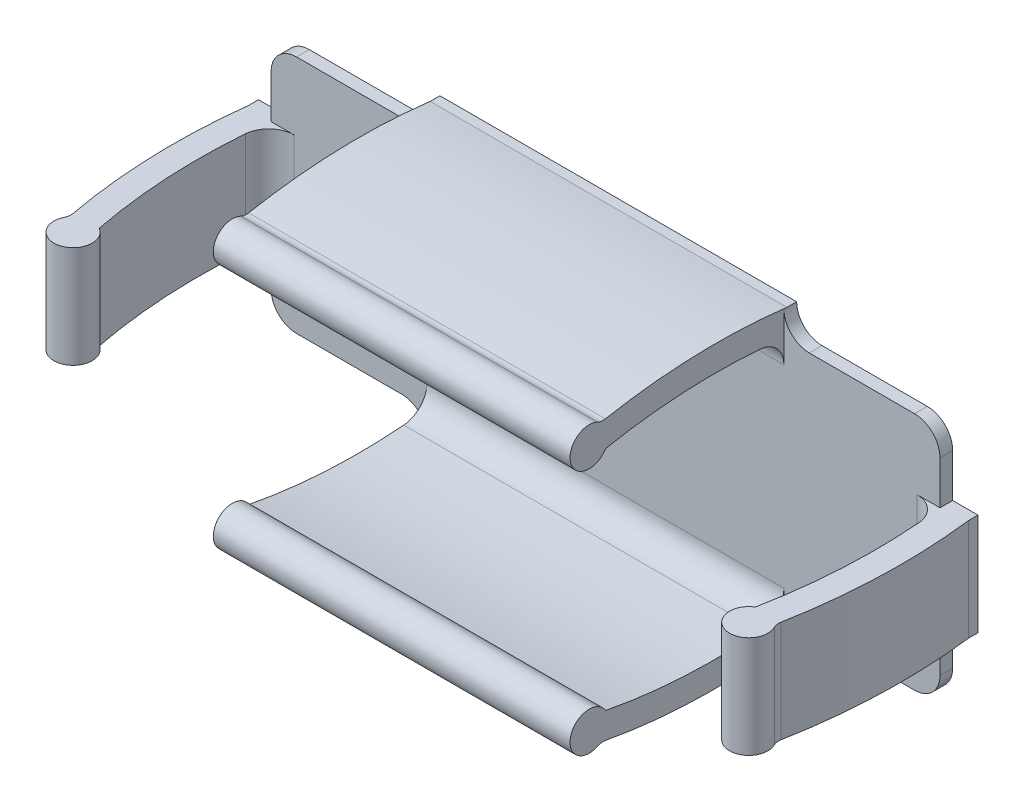
from build123d import *

# Parameters (mm, degrees)
SKETCH1_W           = 52.5
SKETCH1_H           = 18.8
BOSS_EXTRUDE1_DEPTH = 1
BOSS_EXTRUDE2_DEPTH = 4
BOSS_EXTRUDE3_DEPTH = 14
FILLET1_R           = 2
FILLET2_R           = 2
FILLET3_R           = 1


with BuildPart() as part:
    # Sketch1 → Boss-Extrude1 (new body)
    with BuildSketch(Plane.XY):
        Rectangle(SKETCH1_W, SKETCH1_H)
    extrude(amount=BOSS_EXTRUDE1_DEPTH)

    # Sketch2 → Boss-Extrude2 (add, symmetric)
    with BuildSketch(Plane(origin=(0, 0, 0), x_dir=(1, 0, 0), z_dir=(0, 1, 0))):
        with BuildLine():
            Line((-26.25, 0), (-26.25, -1))
            ThreePointArc((-26.25, -1), (-26.547428998, -8.015097806), (-25.75, -14.99106858))
            ThreePointArc((-25.75, -14.99106858), (-26.232288437, -17.75177498), (-27.713282794, -15.372540297))
            ThreePointArc((-27.713282794, -15.372540297), (-28.546153081, -8.086526378), (-28.235505016, -0.759646447))
            Line((-28.235505016, -0.759646447), (-28.235505016, 0))
            Line((-28.235505016, 0), (-26.25, 0))
        make_face()
    boss_extrude2 = extrude(amount=BOSS_EXTRUDE2_DEPTH, both=True)

    # Mirror1: Boss-Extrude2 across plane
    add(boss_extrude2.mirror(Plane(origin=(0, 0, 0), x_dir=(0, 0, 1), z_dir=(1, 0, 0))))

    # Sketch3 → Boss-Extrude3 (add, symmetric)
    with BuildSketch(Plane(origin=(0, 0, 0), x_dir=(0, 0, -1), z_dir=(1, 0, 0))):
        with BuildLine():
            Line((0, 9.4), (-1, 9.4))
            ThreePointArc((-1, 9.4), (-8.019576143, 9.698132003), (-15, 8.9))
            ThreePointArc((-15, 8.9), (-17.760743831, 9.382074127), (-15.381624121, 10.863253175))
            ThreePointArc((-15.381624121, 10.863253175), (-8.090959204, 11.696857712), (-0.759401899, 11.385475397))
            Line((-0.759401899, 11.385475397), (0, 11.385475397))
            Line((0, 11.385475397), (0, 9.4))
        make_face()
    boss_extrude3 = extrude(amount=BOSS_EXTRUDE3_DEPTH, both=True)

    # Mirror2: Boss-Extrude3 across plane
    add(boss_extrude3.mirror(Plane.ZX))

    # Fillet1
    fillet1_edges = [part.edges().sort_by_distance(p)[0] for p in [
        (0, 9.4, 1),
        (-26.25, 0, 1),
        (0, -9.4, 1),
        (26.25, 0, 1),
        (26.25, -9.4, 0.5),
        (26.25, 9.4, 0.5),
        (-26.25, -9.4, 0.5),
        (-26.25, 9.4, 0.5),
    ]]
    fillet(fillet1_edges, radius=FILLET1_R)

    # Fillet2
    # the kernel refuses this fillet: 2 mm, written as the material it adds along each edge
    with BuildSketch(Plane(origin=(-14, -9.4, 0), x_dir=(0, -1, 0), z_dir=(0, 0, 1))) as fillet2_piece_1_section:
        with BuildLine():
            CenterArc((FILLET2_R, -FILLET2_R), FILLET2_R, 90, 90)
            Line((0, -FILLET2_R), (0, 0))
            Line((0, 0), (FILLET2_R, 0))
        make_face()
    fillet2_piece_1 = extrude(amount=1, mode=Mode.PRIVATE)
    fillet2_piece_1 = split(fillet2_piece_1, bisect_by=Plane(origin=(-14.000636708, -11.385475397, 0.169006007), z_dir=(0, 1, 0)), keep=Keep.TOP, mode=Mode.PRIVATE)
    add(fillet2_piece_1)
    with BuildSketch(Plane(origin=(-14, -9.4, -5), x_dir=(0, -1, 0), z_dir=(0, 0, 1))) as fillet2_piece_2_section:
        with BuildLine():
            CenterArc((FILLET2_R, -FILLET2_R), FILLET2_R, 90, 90)
            Line((0, -FILLET2_R), (0, 0))
            Line((0, 0), (FILLET2_R, 0))
        make_face()
    fillet2_piece_2 = extrude(amount=6, mode=Mode.PRIVATE)
    fillet2_piece_2 = split(fillet2_piece_2, bisect_by=Plane(origin=(-14.000016578, -11.385475397, 0.893450241), z_dir=(0, -1, 0)), keep=Keep.TOP, mode=Mode.PRIVATE)
    fillet2_piece_2 = fillet2_piece_2 & Plane(origin=(-14.000016578, 35.273196442, 6.41345727), x_dir=(0, -0.9816265876102759, 0.19081206066862103), z_dir=(1, 0, 0)) * Cylinder(47, 21, mode=Mode.PRIVATE)
    add(fillet2_piece_2)
    with BuildSketch(Plane(origin=(14, -9.4, 0), x_dir=(1, 0, 0), z_dir=(0, 0, 1))) as fillet2_piece_3_section:
        with BuildLine():
            CenterArc((FILLET2_R, -FILLET2_R), FILLET2_R, 90, 90)
            Line((0, -FILLET2_R), (0, 0))
            Line((0, 0), (FILLET2_R, 0))
        make_face()
    fillet2_piece_3 = extrude(amount=1, mode=Mode.PRIVATE)
    fillet2_piece_3 = split(fillet2_piece_3, bisect_by=Plane(origin=(14.446749005, -11.385475397, 0.500009641), z_dir=(0, 1, 0)), keep=Keep.TOP, mode=Mode.PRIVATE)
    add(fillet2_piece_3)
    with BuildSketch(Plane(origin=(14, -9.4, -5), x_dir=(1, 0, 0), z_dir=(0, 0, 1))) as fillet2_piece_4_section:
        with BuildLine():
            CenterArc((FILLET2_R, -FILLET2_R), FILLET2_R, 90, 90)
            Line((0, -FILLET2_R), (0, 0))
            Line((0, 0), (FILLET2_R, 0))
        make_face()
    fillet2_piece_4 = extrude(amount=6, mode=Mode.PRIVATE)
    fillet2_piece_4 = split(fillet2_piece_4, bisect_by=Plane(origin=(14.000016578, -11.385475397, 0.893450335), z_dir=(0, -1, 0)), keep=Keep.TOP, mode=Mode.PRIVATE)
    fillet2_piece_4 = fillet2_piece_4 & Plane(origin=(14.000016578, 35.273196442, 6.41345727), x_dir=(0, -0.9816265876102759, 0.19081206066862103), z_dir=(1, 0, 0)) * Cylinder(47, 20, mode=Mode.PRIVATE)
    add(fillet2_piece_4)
    with BuildSketch(Plane(origin=(14, 9.4, 0), x_dir=(1, 0, 0), z_dir=(0, 0, 1))) as fillet2_piece_5_section:
        with BuildLine():
            CenterArc((FILLET2_R, FILLET2_R), FILLET2_R, 180, 90)
            Line((0, FILLET2_R), (0, 0))
            Line((0, 0), (FILLET2_R, 0))
        make_face()
    fillet2_piece_5 = extrude(amount=1, mode=Mode.PRIVATE)
    fillet2_piece_5 = split(fillet2_piece_5, bisect_by=Plane(origin=(14.446749005, 11.385475397, 0.500009641), z_dir=(0, -1, 0)), keep=Keep.TOP, mode=Mode.PRIVATE)
    add(fillet2_piece_5)
    with BuildSketch(Plane(origin=(14, 9.4, -5), x_dir=(1, 0, 0), z_dir=(0, 0, 1))) as fillet2_piece_6_section:
        with BuildLine():
            CenterArc((FILLET2_R, FILLET2_R), FILLET2_R, 180, 90)
            Line((0, FILLET2_R), (0, 0))
            Line((0, 0), (FILLET2_R, 0))
        make_face()
    fillet2_piece_6 = extrude(amount=6, mode=Mode.PRIVATE)
    fillet2_piece_6 = split(fillet2_piece_6, bisect_by=Plane(origin=(14.000016578, 11.385475397, 0.893450335), z_dir=(0, 1, 0)), keep=Keep.TOP, mode=Mode.PRIVATE)
    fillet2_piece_6 = fillet2_piece_6 & Plane(origin=(14.000016578, -35.273196442, 6.41345727), x_dir=(0, 0.9816265876102759, 0.19081206066862103), z_dir=(1, 0, 0)) * Cylinder(47, 21, mode=Mode.PRIVATE)
    add(fillet2_piece_6)
    with BuildSketch(Plane(origin=(-14, 9.4, 0), x_dir=(0, 1, 0), z_dir=(0, 0, 1))) as fillet2_piece_7_section:
        with BuildLine():
            CenterArc((FILLET2_R, FILLET2_R), FILLET2_R, 180, 90)
            Line((0, FILLET2_R), (0, 0))
            Line((0, 0), (FILLET2_R, 0))
        make_face()
    fillet2_piece_7 = extrude(amount=1, mode=Mode.PRIVATE)
    fillet2_piece_7 = split(fillet2_piece_7, bisect_by=Plane(origin=(-14.000636708, 11.385475397, 0.169006007), z_dir=(0, -1, 0)), keep=Keep.TOP, mode=Mode.PRIVATE)
    add(fillet2_piece_7)
    with BuildSketch(Plane(origin=(-14, 9.4, -5), x_dir=(0, 1, 0), z_dir=(0, 0, 1))) as fillet2_piece_8_section:
        with BuildLine():
            CenterArc((FILLET2_R, FILLET2_R), FILLET2_R, 180, 90)
            Line((0, FILLET2_R), (0, 0))
            Line((0, 0), (FILLET2_R, 0))
        make_face()
    fillet2_piece_8 = extrude(amount=6, mode=Mode.PRIVATE)
    fillet2_piece_8 = split(fillet2_piece_8, bisect_by=Plane(origin=(-14.000016578, 11.385475397, 0.893450241), z_dir=(0, 1, 0)), keep=Keep.TOP, mode=Mode.PRIVATE)
    fillet2_piece_8 = fillet2_piece_8 & Plane(origin=(-14.000016578, -35.273196442, 6.41345727), x_dir=(0, 0.9816265876102759, 0.19081206066862103), z_dir=(1, 0, 0)) * Cylinder(47, 20, mode=Mode.PRIVATE)
    add(fillet2_piece_8)

    # Fillet3
    fillet3_edges = [part.edges().sort_by_distance(p)[0] for p in [
        (-27.713282794, 0, 15.372540297),
        (27.713282794, 0, 15.372540297),
        (0, 10.863253175, 15.381624121),
        (0, -10.863253175, 15.381624121),
    ]]
    fillet(fillet3_edges, radius=FILLET3_R)


solid = part.part
